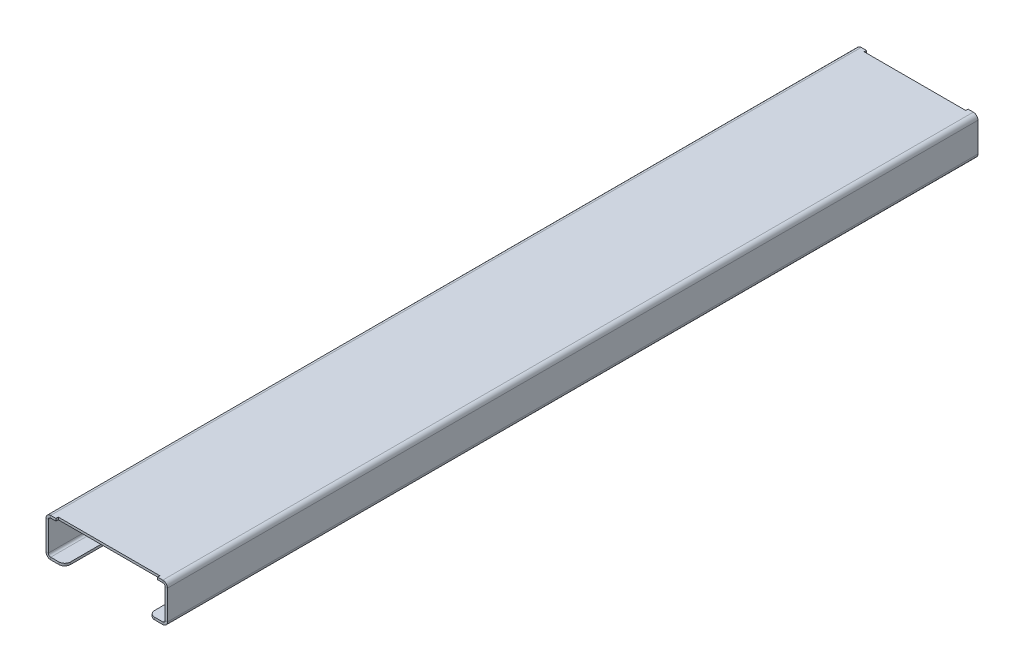
from build123d import *

# Parameters (mm, degrees)
BASE_FLANGE1_DEPTH = 347
SKETCH4_W          = 87
SKETCH4_H          = 2
CUT_EXTRUDE1_DEPTH = 10
SKETCH8_R          = 2.5
CUT_EXTRUDE5_DEPTH = 10
LPATTERN4_COUNT    = 2
LPATTERN4_PITCH    = 424
FILLET1_R          = 5


# Sheet-metal steps are written as plain solids
with BuildPart() as part:
    # Sketch3 → Base-Flange1 (new, symmetric)
    with BuildSketch(Plane.XY):
        with BuildLine():
            Line((36, -33), (48, -33))
            ThreePointArc((48, -33), (50.828427125, -31.828427125), (52, -29))
            Line((52, -29), (52, -4))
            ThreePointArc((52, -4), (50.828427125, -1.171572875), (48, 0))
            Line((48, 0), (-48, 0))
            ThreePointArc((-48, 0), (-50.828427125, -1.171572875), (-52, -4))
            Line((-52, -4), (-52, -29))
            ThreePointArc((-52, -29), (-50.828427125, -31.828427125), (-48, -33))
            Line((-48, -33), (-36, -33))
            Line((-36, -33), (-36, -31))
            Line((-36, -31), (-48, -31))
            ThreePointArc((-48, -31), (-49.414213562, -30.414213562), (-50, -29))
            Line((-50, -29), (-50, -4))
            ThreePointArc((-50, -4), (-49.414213562, -2.585786438), (-48, -2))
            Line((-48, -2), (48, -2))
            ThreePointArc((48, -2), (49.414213562, -2.585786438), (50, -4))
            Line((50, -4), (50, -29))
            ThreePointArc((50, -29), (49.414213562, -30.414213562), (48, -31))
            Line((48, -31), (36, -31))
            Line((36, -31), (36, -33))
        make_face()
    extrude(amount=BASE_FLANGE1_DEPTH, both=True)

    # Sketch4 → Cut-Extrude1 (cut)
    with BuildSketch(Plane(origin=(0, 0, 0), x_dir=(1, 0, 0), z_dir=(0, 1, 0))):
        with Locations((0, -346)):
            Rectangle(SKETCH4_W, SKETCH4_H)
        with Locations((0, 346)):
            Rectangle(SKETCH4_W, SKETCH4_H)
    extrude(amount=-CUT_EXTRUDE1_DEPTH, mode=Mode.SUBTRACT)

    # Sketch8 → Cut-Extrude5 (cut)
    with BuildSketch(Plane.ZY.offset(52)):
        with Locations(Location((177, -9, 0), (0, 0, 270))):
            Circle(SKETCH8_R)
        with Locations(Location((247, -9, 0), (0, 0, 270))):
            Circle(SKETCH8_R)
    cut_extrude5 = extrude(amount=-CUT_EXTRUDE5_DEPTH, mode=Mode.SUBTRACT)

    # LPattern4: Cut-Extrude5 ×2
    with Locations(*[(0, 0, -i * LPATTERN4_PITCH) for i in range(1, LPATTERN4_COUNT)]):
        add(cut_extrude5, mode=Mode.SUBTRACT)

    # Fillet1
    fillet1_edges = [part.edges().sort_by_distance(p)[0] for p in [
        (-36, -32, -347),
        (36, -32, -347),
        (-36, -32, 347),
        (36, -32, 347),
    ]]
    fillet(fillet1_edges, radius=FILLET1_R)


solid = part.part
